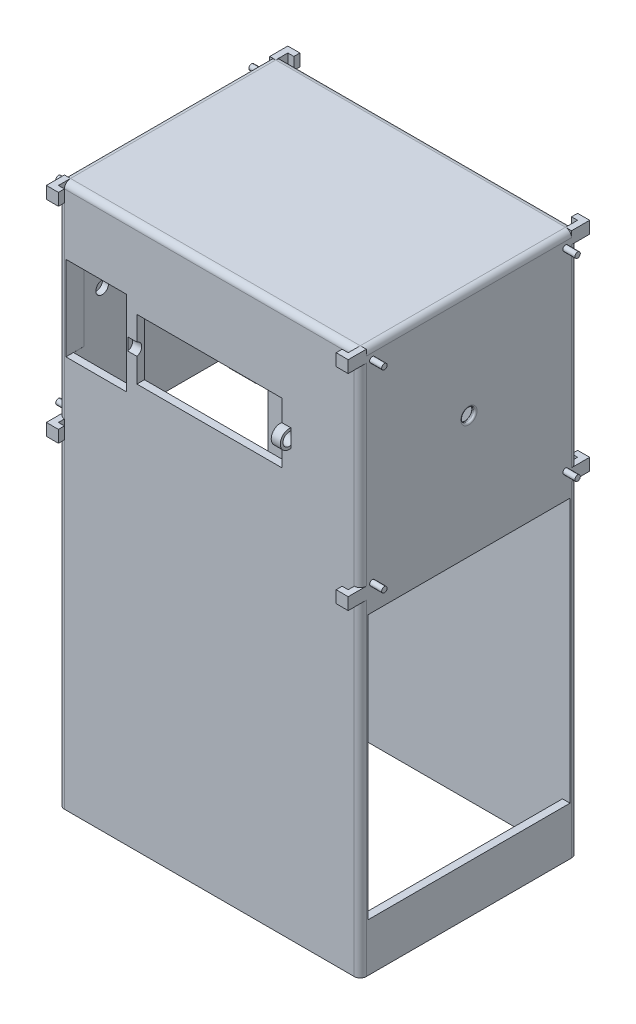
from build123d import *

# Parameters (mm, degrees)
SKETCH1_W            = 127
SKETCH1_H            = 91.44
BOSS_EXTRUDE1_DEPTH  = 228.6
SKETCH3_W            = 120.65
SKETCH3_H            = 85.09
CUT_EXTRUDE1_DEPTH   = 226.06
SKETCH2_R            = 2.667
CUT_EXTRUDE2_DEPTH   = 266.475570251
SKETCH4_R            = 1.143
BOSS_EXTRUDE3_DEPTH  = 5.08
SKETCH5_R            = 20.32
CUT_EXTRUDE3_DEPTH   = 1.27
FILLET1_R            = 0.762
FILLET2_R            = 0.762
FILLET3_R            = 0.762
SKETCH6_W            = 60.96
SKETCH6_H            = 25.4
CUT_EXTRUDE4_DEPTH   = 256.582569828
FILLET4_R            = 2.54
SKETCH7_W            = 85.09
SKETCH7_H            = 111.152565629
CUT_EXTRUDE5_DEPTH   = 268.942913323
SKETCH10_R           = 2.667
CUT_EXTRUDE6_DEPTH   = 2.54
CUT_EXTRUDE7_DEPTH   = 7.62
SKETCH13_R           = 2.667
CUT_EXTRUDE8_DEPTH   = 2.54
CUT_EXTRUDE9_DEPTH   = 7.62
SKETCH20_W           = 11.43
SKETCH20_H           = 7.62
BOSS_EXTRUDE4_DEPTH  = 50.8
CUT_EXTRUDE10_START  = -12.7
SKETCH21_R           = 2.667
CUT_EXTRUDE10_DEPTH  = 12.7
CUT_EXTRUDE11_DEPTH  = 12.7
SKETCH24_R           = 3.81
BOSS_EXTRUDE5_DEPTH  = 3.81
SKETCH25_R           = 2.667
CUT_EXTRUDE12_DEPTH  = 3.81
CUT_EXTRUDE13_DEPTH  = 12.7
CUT_EXTRUDE14_START  = 64.77
SKETCH27_R           = 2.667
CUT_EXTRUDE14_DEPTH  = 64.77
CUT_EXTRUDE15_START  = 64.77
SKETCH29_R           = 2.667
CUT_EXTRUDE15_DEPTH  = 64.77
FILLET6_R            = 50.8
FILLET7_R            = 50.8
BOSS_EXTRUDE6_DEPTH  = 5.08
MIRROR5_COPY_1_DEPTH = 5.08
MIRROR6_COPY_1_DEPTH = 5.08
MIRROR6_COPY_2_DEPTH = 5.08
MIRROR6_COPY_3_DEPTH = 5.08


with BuildPart() as part:
    # Sketch1 → Boss-Extrude1 (new body)
    with BuildSketch(Plane(origin=(0, 0, 0), x_dir=(1, 0, 0), z_dir=(0, 1, 0))):
        Rectangle(SKETCH1_W, SKETCH1_H)
    extrude(amount=BOSS_EXTRUDE1_DEPTH)

    # Sketch3 → Cut-Extrude1 (cut)
    with BuildSketch(Plane.XZ):
        Rectangle(SKETCH3_W, SKETCH3_H)
    extrude(amount=-CUT_EXTRUDE1_DEPTH, mode=Mode.SUBTRACT)

    # Sketch2 → Cut-Extrude2 (cut, through all)
    with BuildSketch(Plane(origin=(63.5, 0, 0), x_dir=(0, 0, -1), z_dir=(1, 0, 0))):
        with Locations((0, 182.88)):
            Circle(SKETCH2_R)
    extrude(amount=-CUT_EXTRUDE2_DEPTH, mode=Mode.SUBTRACT)

    # Sketch4 → Boss-Extrude3 (add)
    with BuildSketch(Plane(origin=(63.5, 0, 0), x_dir=(0, 0, -1), z_dir=(1, 0, 0))):
        with Locations(Location((-40.64, 223.52, 0), (0, 0, 180))):
            Circle(SKETCH4_R)
        with Locations(Location((40.64, 223.52, 0), (0, 0, 180))):
            Circle(SKETCH4_R)
        with Locations(Location((40.64, 142.24, 0), (0, 0, 180))):
            Circle(SKETCH4_R)
        with Locations(Location((-40.64, 142.24, 0), (0, 0, 180))):
            Circle(SKETCH4_R)
    boss_extrude3 = extrude(amount=BOSS_EXTRUDE3_DEPTH)

    # Sketch5 → Cut-Extrude3 (cut)
    with BuildSketch(Plane.ZY.offset(-60.325)):
        with Locations((0, 182.88)):
            Circle(SKETCH5_R)
    cut_extrude3 = extrude(amount=-CUT_EXTRUDE3_DEPTH, mode=Mode.SUBTRACT)

    # Fillet1
    fillet1_edges = [part.edges().sort_by_distance(p)[0] for p in [
        (61.595, 182.88, 2.667),
    ]]
    fillet(fillet1_edges, radius=FILLET1_R)

    # Fillet2
    fillet2_edges = [part.edges().sort_by_distance(p)[0] for p in [
        (63.5, 182.88, 2.667),
    ]]
    fillet(fillet2_edges, radius=FILLET2_R)

    # Mirror2: Boss-Extrude3, Cut-Extrude3 across plane
    add(boss_extrude3.mirror(Plane(origin=(0, 0, 0), x_dir=(0, 0, 1), z_dir=(1, 0, 0))))
    add(cut_extrude3.mirror(Plane(origin=(0, 0, 0), x_dir=(0, 0, 1), z_dir=(1, 0, 0))), mode=Mode.SUBTRACT)

    # Fillet3
    fillet3_edges = [part.edges().sort_by_distance(p)[0] for p in [
        (-63.5, 182.88, 2.667),
        (-61.595, 182.88, 2.667),
    ]]
    fillet(fillet3_edges, radius=FILLET3_R)

    # Sketch6 → Cut-Extrude4 (cut, through all)
    with BuildSketch(Plane.XY.offset(45.72)):
        with Locations((0, 182.88)):
            Rectangle(SKETCH6_W, SKETCH6_H)
    extrude(amount=-CUT_EXTRUDE4_DEPTH, mode=Mode.SUBTRACT)

    # Fillet4
    fillet4_edges = [part.edges().sort_by_distance(p)[0] for p in [
        (-63.5, 228.6, 0),
        (0, 228.6, 45.72),
        (63.5, 228.6, 0),
        (63.5, 114.3, 45.72),
        (-63.5, 114.3, 45.72),
        (-63.5, 114.3, -45.72),
        (63.5, 114.3, -45.72),
        (0, 228.6, -45.72),
    ]]
    fillet(fillet4_edges, radius=FILLET4_R)

    # Sketch7 → Cut-Extrude5 (cut, through all)
    with BuildSketch(Plane(origin=(63.5, 0, 0), x_dir=(0, 0, -1), z_dir=(1, 0, 0))):
        with Locations((0, 75.896282814)):
            Rectangle(SKETCH7_W, SKETCH7_H)
    extrude(amount=-CUT_EXTRUDE5_DEPTH, mode=Mode.SUBTRACT)

    # Sketch10 → Cut-Extrude6 (cut)
    with BuildSketch(Plane.ZY.offset(-60.325)):
        with Locations((-30.48, 182.88)):
            Circle(SKETCH10_R)
    extrude(amount=-CUT_EXTRUDE6_DEPTH, mode=Mode.SUBTRACT)

    # Sketch12 → Cut-Extrude7 (cut)
    with BuildSketch(Plane(origin=(0, 0, -45.72), x_dir=(-1, 0, 0), z_dir=(0, 0, -1))):
        Polygon((-34.810362372, 182.807903476), (-34.810362372, 200.587903476), (-60.210362372, 200.587903476), (-60.210362372, 182.807903476), (-60.210362372, 165.027903476), (-34.810362372, 165.027903476), align=None)
    extrude(amount=-CUT_EXTRUDE7_DEPTH, mode=Mode.SUBTRACT)

    # Sketch13 → Cut-Extrude8 (cut)
    with BuildSketch(Plane(origin=(-60.325, 0, 0), x_dir=(0, 0, -1), z_dir=(1, 0, 0))):
        with Locations((-30.48, 182.88)):
            Circle(SKETCH13_R)
    extrude(amount=-CUT_EXTRUDE8_DEPTH, mode=Mode.SUBTRACT)

    # Sketch16 → Cut-Extrude9 (cut)
    with BuildSketch(Plane.XY.offset(45.72)):
        Polygon((-60.34639287, 182.934228321), (-60.34639287, 200.714228321), (-34.94639287, 200.714228321), (-34.94639287, 165.154228321), (-60.34639287, 165.154228321), align=None)
    extrude(amount=-CUT_EXTRUDE9_DEPTH, mode=Mode.SUBTRACT)

    # Sketch20 → Boss-Extrude4 (add)
    with BuildSketch(Plane.XZ.offset(-226.06)):
        with Locations((1.27, -30.48)):
            Rectangle(SKETCH20_W, SKETCH20_H)
    boss_extrude4 = extrude(amount=BOSS_EXTRUDE4_DEPTH)

    # Sketch21 → Cut-Extrude10 (cut)
    with BuildSketch(Plane(origin=(6.985, 0, 0), x_dir=(0, 0, -1), z_dir=(1, 0, 0)).offset(CUT_EXTRUDE10_START)):
        with Locations(Location((30.48, 182.88, 0), (0, 0, 180))):
            Circle(SKETCH21_R)
    cut_extrude10 = extrude(amount=CUT_EXTRUDE10_DEPTH, mode=Mode.SUBTRACT)

    # Sketch23 → Cut-Extrude11 (cut)
    with BuildSketch(Plane(origin=(6.985, 0, 0), x_dir=(0, 0, -1), z_dir=(1, 0, 0))):
        Polygon((27.813, 182.88), (26.67, 182.88), (26.67, 175.26), (34.29, 175.26), (34.29, 182.88), align=None)
    extrude(amount=-CUT_EXTRUDE11_DEPTH, mode=Mode.SUBTRACT)

    # Sketch24 → Boss-Extrude5 (add)
    with BuildSketch(Plane.ZY.offset(-30.48)):
        with Locations((-46.355, 182.88)):
            Circle(SKETCH24_R)
    boss_extrude5 = extrude(amount=-BOSS_EXTRUDE5_DEPTH)

    # Sketch25 → Cut-Extrude12 (cut)
    with BuildSketch(Plane.ZY.offset(-30.48)):
        with Locations((-46.355, 182.88)):
            Circle(SKETCH25_R)
    cut_extrude12 = extrude(amount=-CUT_EXTRUDE12_DEPTH, mode=Mode.SUBTRACT)

    # Mirror3: Boss-Extrude4, Cut-Extrude10, Boss-Extrude5, Cut-Extrude12 across plane
    add(boss_extrude4.mirror(Plane.XY))
    add(cut_extrude10.mirror(Plane.XY), mode=Mode.SUBTRACT)
    add(boss_extrude5.mirror(Plane.XY))
    add(cut_extrude12.mirror(Plane.XY), mode=Mode.SUBTRACT)

    # Sketch26 → Cut-Extrude13 (cut)
    with BuildSketch(Plane(origin=(6.985, 0, 0), x_dir=(0, 0, -1), z_dir=(1, 0, 0))):
        Polygon((-27.813, 182.88), (-26.67, 182.88), (-26.67, 175.26), (-34.29, 175.26), (-34.29, 182.88), align=None)
    extrude(amount=-CUT_EXTRUDE13_DEPTH, mode=Mode.SUBTRACT)

    # Sketch27 → Cut-Extrude14 (cut)
    with BuildSketch(Plane.ZY.offset(-30.48).offset(CUT_EXTRUDE14_START)):
        with Locations((-46.355, 182.88)):
            Circle(SKETCH27_R)
    extrude(amount=-CUT_EXTRUDE14_DEPTH, mode=Mode.SUBTRACT)

    # Sketch29 → Cut-Extrude15 (cut)
    with BuildSketch(Plane.ZY.offset(-30.48).offset(CUT_EXTRUDE15_START)):
        with Locations(Location((46.355, 182.88, 0), (0, 0, 256.225853002))):
            Circle(SKETCH29_R)
    extrude(amount=-CUT_EXTRUDE15_DEPTH, mode=Mode.SUBTRACT)

    # Fillet6
    # the kernel refuses this fillet: 50.8 mm, written as the material it takes off along each edge
    with BuildSketch(Plane(origin=(33.773797915, 182.88, 34.29), x_dir=(0, 0, -1), z_dir=(-1, 0, 0))) as fillet6_piece_1:
        with BuildLine():
            CenterArc((50.8, -10.715519166), FILLET6_R, 167.822824326, 12.177175674)
            Line((0, -10.715519166), (-1.016, -10.715519166))
            Line((-1.016, -10.715519166), (-1.016, 0))
            Line((-1.016, 0), (0, 1.016))
            ThreePointArc((0, 1.016), (0.5715, 1.016), (0.14986, 0.214310383))
            Line((0.14986, 0.214310383), (1.143, 0))
        make_face()
    extrude(amount=65.007595831, mode=Mode.SUBTRACT)

    # Fillet7
    # the kernel refuses this fillet: 50.8 mm, written as the material it takes off along each edge
    with BuildSketch(Plane(origin=(33.773797915, 182.88, -34.29), x_dir=(0, 1, 0), z_dir=(-1, 0, 0))) as fillet7_piece_1:
        with BuildLine():
            CenterArc((10.715519166, -50.8), FILLET7_R, 90, 12.177175674)
            Line((0, -1.143), (0, 0))
            Line((0, 0), (10.715519166, 0))
        make_face()
    extrude(amount=65.007595831, mode=Mode.SUBTRACT)

    # Sketch33 → Boss-Extrude6 (add)
    with BuildSketch(Plane(origin=(0, 228.6, 0), x_dir=(1, 0, 0), z_dir=(0, 1, 0))):
        Polygon((63.5, 43.18), (63.5, 50.8), (58.42, 50.8), (58.42, 48.26), (60.96, 48.26), (60.96, 43.18), align=None)
    boss_extrude6 = extrude(amount=-BOSS_EXTRUDE6_DEPTH)

    # Mirror4: Boss-Extrude6 across plane
    add(boss_extrude6.mirror(Plane(origin=(0, 0, 0), x_dir=(0, 0, 1), z_dir=(1, 0, 0))))

    # Mirror5: Boss-Extrude6 across plane
    add(boss_extrude6.mirror(Plane.ZX.offset(182.88)))

    # Mirror5 copy 1 sketch → Mirror5 copy 1 (add)
    with BuildSketch(Plane(origin=(0, 137.16, 0), x_dir=(-1, 0, 0), z_dir=(0, -1, 0))):
        Polygon((63.5, 43.18), (63.5, 50.8), (58.42, 50.8), (58.42, 48.26), (60.96, 48.26), (60.96, 43.18), align=None)
    extrude(amount=-MIRROR5_COPY_1_DEPTH)

    # Mirror6: Boss-Extrude6 across plane
    add(boss_extrude6.mirror(Plane.XY))

    # Mirror6 copy 1 sketch → Mirror6 copy 1 (add)
    with BuildSketch(Plane(origin=(0, 228.6, 0), x_dir=(-1, 0, 0), z_dir=(0, 1, 0))):
        Polygon((63.5, 43.18), (63.5, 50.8), (58.42, 50.8), (58.42, 48.26), (60.96, 48.26), (60.96, 43.18), align=None)
    extrude(amount=-MIRROR6_COPY_1_DEPTH)

    # Mirror6 copy 2 sketch → Mirror6 copy 2 (add)
    with BuildSketch(Plane.XZ.offset(-137.16)):
        Polygon((63.5, 43.18), (63.5, 50.8), (58.42, 50.8), (58.42, 48.26), (60.96, 48.26), (60.96, 43.18), align=None)
    extrude(amount=-MIRROR6_COPY_2_DEPTH)

    # Mirror6 copy 3 sketch → Mirror6 copy 3 (add)
    with BuildSketch(Plane(origin=(0, 137.16, 0), x_dir=(-1, 0, 0), z_dir=(0, -1, 0))):
        Polygon((63.5, -43.18), (63.5, -50.8), (58.42, -50.8), (58.42, -48.26), (60.96, -48.26), (60.96, -43.18), align=None)
    extrude(amount=-MIRROR6_COPY_3_DEPTH)


solid = part.part
